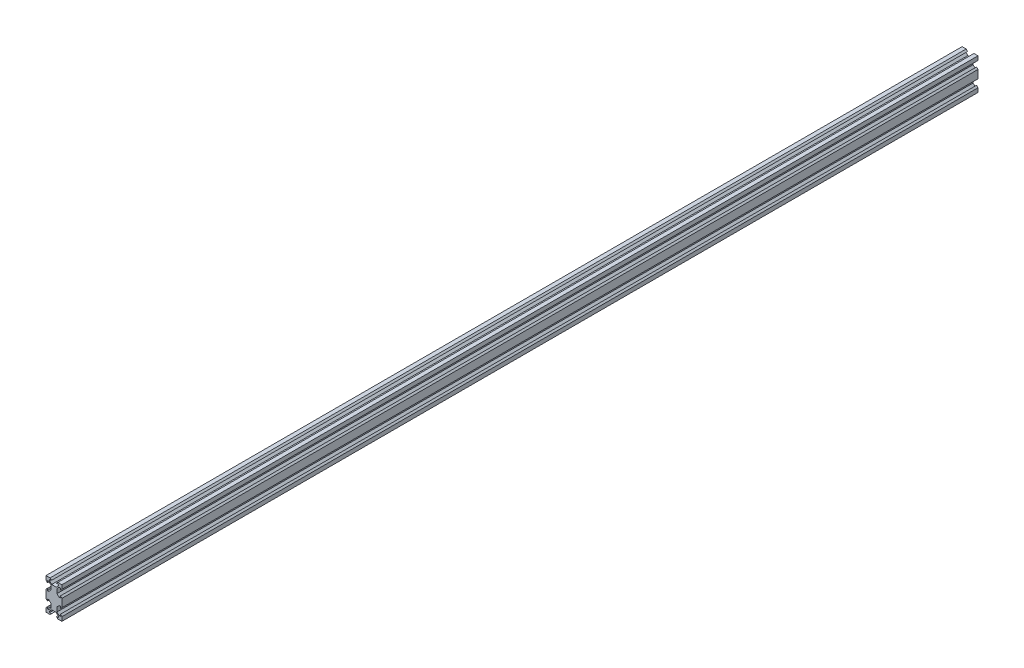
from build123d import *

# Parameters (mm, degrees)
SKETCH1_W           = 20
SKETCH1_H           = 40
BOSS_EXTRUDE1_DEPTH = 1153.3
CUT_EXTRUDE1_DEPTH  = 1155.166751384


with BuildPart() as part:
    # Sketch1 → Boss-Extrude1 (new body)
    with BuildSketch(Plane.XY):
        with Locations((10, 20)):
            Rectangle(SKETCH1_W, SKETCH1_H)
    extrude(amount=BOSS_EXTRUDE1_DEPTH)

    # Sketch2 → Cut-Extrude1 (cut, through all)
    with BuildSketch(Plane.XY.offset(1153.3)):
        Polygon((5.12, 40), (6.94, 38.18), (4.5, 38.18), (4.5, 36.475807358), (7.165807358, 33.81), (12.834192642, 33.81), (15.5, 36.475807358), (15.5, 38.18), (13.06, 38.18), (14.88, 40), align=None)
        Polygon((18.18, 35.5), (18.18, 33.06), (20, 34.88), (20, 25.12), (18.18, 26.94), (18.18, 24.5), (16.475807358, 24.5), (13.81, 27.165807358), (13.81, 32.834192642), (16.475807358, 35.5), align=None)
        Polygon((20, 14.88), (18.18, 13.06), (18.18, 15.5), (16.475807358, 15.5), (13.81, 12.834192642), (13.81, 7.165807358), (16.475807358, 4.5), (18.18, 4.5), (18.18, 6.94), (20, 5.12), align=None)
        Polygon((15.5, 1.82), (13.06, 1.82), (14.88, 0), (5.12, 0), (6.94, 1.82), (4.5, 1.82), (4.5, 3.524192642), (7.165807358, 6.19), (12.834192642, 6.19), (15.5, 3.524192642), align=None)
        Polygon((1.82, 4.5), (1.82, 6.94), (0, 5.12), (0, 14.88), (1.82, 13.06), (1.82, 15.5), (3.524192642, 15.5), (6.19, 12.834192642), (6.19, 7.165807358), (3.524192642, 4.5), align=None)
        Polygon((0, 25.12), (1.82, 26.94), (1.82, 24.5), (3.524192642, 24.5), (6.19, 27.165807358), (6.19, 32.834192642), (3.524192642, 35.5), (1.82, 35.5), (1.82, 33.06), (0, 34.88), align=None)
    extrude(amount=-CUT_EXTRUDE1_DEPTH, mode=Mode.SUBTRACT)


solid = part.part
